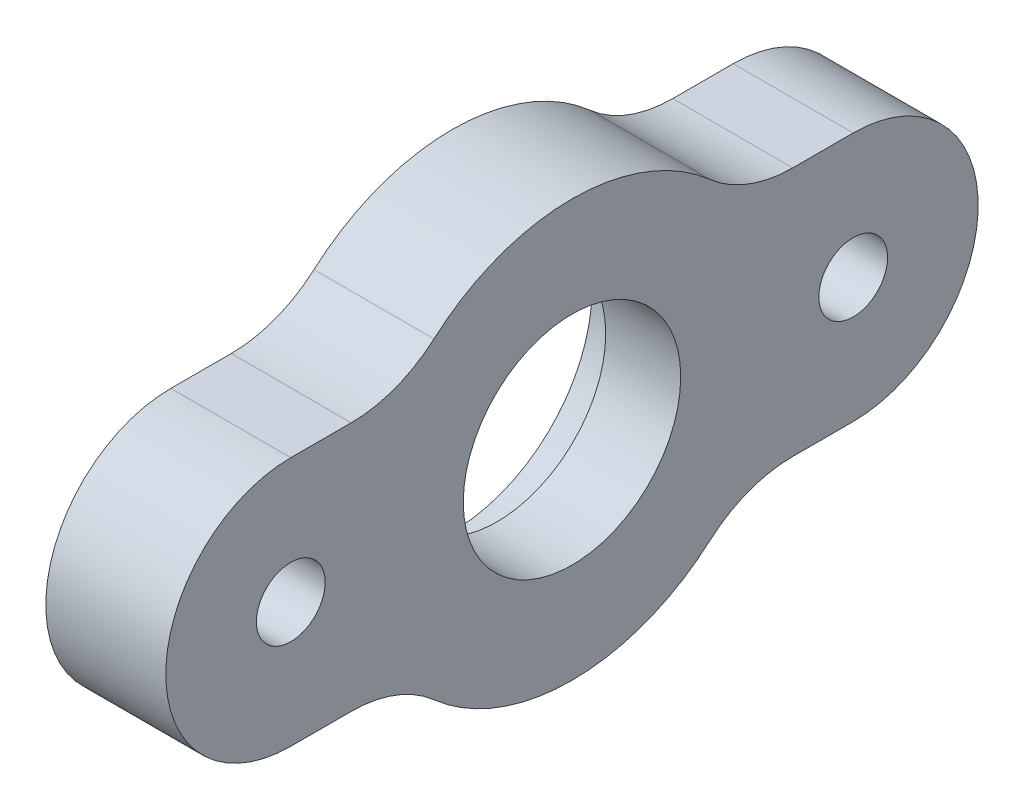
from build123d import *

# Parameters (mm, degrees)
AUFSATZ_LINEAR_START             = -9.6
AUFSATZ_LINEAR_AUSTRAGEN1_DEPTH  = 9.6
F_5_5_5_5_DURCHMESSER_BOHRUNG1_D = 5.5
VERRUNDUNG2_R                    = 10


with BuildPart() as part:
    # Skizze4 → Rotation1 (revolve)
    with BuildSketch(Plane.XY):
        Polygon((0, 11.2), (3.6, 11.2), (3.6, 8.7), (9.6, 8.7), (9.6, 16.683058648), (0, 16.683058648), align=None)
    revolve(axis=Axis((0, 0, 0), (1, 0, 0)))

    # Skizze5 → Aufsatz-Linear austragen1 (add)
    with BuildSketch(Plane(origin=(9.6, 0, 0), x_dir=(0, 0, -1), z_dir=(1, 0, 0)).offset(AUFSATZ_LINEAR_START)):
        with BuildLine():
            Line((-22.5, 10), (-13.35381765, 10))
            ThreePointArc((-13.35381765, 10), (-16.683058648, 0), (-13.35381765, -10))
            Line((-13.35381765, -10), (-22.5, -10))
            ThreePointArc((-22.5, -10), (-32.5, 0), (-22.5, 10))
        make_face()
    aufsatz_linear_austragen1 = extrude(amount=AUFSATZ_LINEAR_AUSTRAGEN1_DEPTH)

    # Ø5.5 (5.5) Durchmesser Bohrung1 (through all)
    with Locations(Plane(origin=(9.6, 0, 0), x_dir=(0, 0, -1), z_dir=(1, 0, 0))):
        with Locations((-22.5, 0)):
            f_5_5_5_5_durchmesser_bohrung1 = Hole(F_5_5_5_5_DURCHMESSER_BOHRUNG1_D / 2)

    # Spiegeln1: Aufsatz-Linear austragen1, Ø5.5 (5.5) Durchmesser Bohrung1 across plane
    add(aufsatz_linear_austragen1.mirror(Plane.XY))
    add(f_5_5_5_5_durchmesser_bohrung1.mirror(Plane.XY), mode=Mode.SUBTRACT)

    # Verrundung2
    verrundung2_edges = [part.edges().sort_by_distance(p)[0] for p in [
        (4.8, -10, 13.35381765),
        (4.8, 10, 13.35381765),
        (4.8, -10, -13.35381765),
        (4.8, 10, -13.35381765),
    ]]
    fillet(verrundung2_edges, radius=VERRUNDUNG2_R)


solid = part.part
